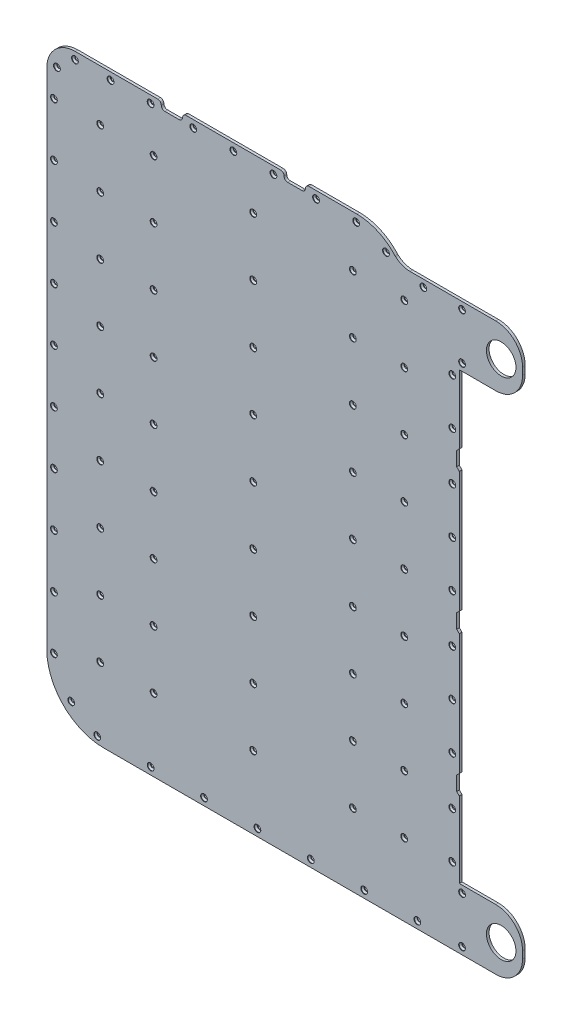
from build123d import *

# Parameters (mm, degrees)
SKETCH1_W                                      = 267.354069382
SKETCH1_H                                      = 331
BOSS_EXTRUDE1_DEPTH                            = 1.5
CUT_EXTRUDE1_DEPTH                             = 426.489657236
CUT_EXTRUDE2_DEPTH                             = 426.489657236
CUT_EXTRUDE3_DEPTH                             = 426.489657236
CUT_EXTRUDE4_DEPTH                             = 426.489657236
M14_CLEARANCE_HOLE1_D                          = 16.15
CSK_FOR_M2_FLAT_HEAD_MACHINE_SCREW1_AT_2_COUNT = 2
CSK_FOR_M2_FLAT_HEAD_MACHINE_SCREW1_AT_2_PITCH = 119.634610245
CSK_FOR_M2_FLAT_HEAD_MACHINE_SCREW1_AT_3_COUNT = 2
CSK_FOR_M2_FLAT_HEAD_MACHINE_SCREW1_AT_3_PITCH = 261.247192787
CSK_FOR_M2_FLAT_HEAD_MACHINE_SCREW1_AT_4_COUNT = 2
CSK_FOR_M2_FLAT_HEAD_MACHINE_SCREW1_AT_4_PITCH = 200.44941981
CSK_FOR_M2_FLAT_HEAD_MACHINE_SCREW1_AT_5_COUNT = 2
CSK_FOR_M2_FLAT_HEAD_MACHINE_SCREW1_AT_5_PITCH = 60
CSK_FOR_M2_FLAT_HEAD_MACHINE_SCREW1_AT_6_COUNT = 2
CSK_FOR_M2_FLAT_HEAD_MACHINE_SCREW1_AT_6_PITCH = 150
CSK_FOR_M2_FLAT_HEAD_MACHINE_SCREW1_AT_7_COUNT = 2
CSK_FOR_M2_FLAT_HEAD_MACHINE_SCREW1_AT_7_PITCH = 104.020522584
CSK_FOR_M2_FLAT_HEAD_MACHINE_SCREW1_AT_8_COUNT = 2
CSK_FOR_M2_FLAT_HEAD_MACHINE_SCREW1_AT_8_PITCH = 304.224078439
CSK_FOR_M2_FLAT_HEAD_MACHINE_SCREW1_AT_9_COUNT = 2
CSK_FOR_M2_FLAT_HEAD_MACHINE_SCREW1_AT_9_PITCH = 241.10255073
CSK_FOR_M2_FLAT_HEAD_MACHINE_SCREW1_AT_1_COUNT = 2
CSK_FOR_M2_FLAT_HEAD_MACHINE_SCREW1_AT_1_PITCH = 151.792937809
CSK_FOR_M2_FLAT_HEAD_MACHINE_SCREW1_2_COUNT    = 2
CSK_FOR_M2_FLAT_HEAD_MACHINE_SCREW1_2_PITCH    = 167.620476666
CSK_FOR_M2_FLAT_HEAD_MACHINE_SCREW1_3_COUNT    = 2
CSK_FOR_M2_FLAT_HEAD_MACHINE_SCREW1_3_PITCH    = 120
CSK_FOR_M2_FLAT_HEAD_MACHINE_SCREW1_4_COUNT    = 2
CSK_FOR_M2_FLAT_HEAD_MACHINE_SCREW1_4_PITCH    = 223.752496974
CSK_FOR_M2_FLAT_HEAD_MACHINE_SCREW1_5_COUNT    = 2
CSK_FOR_M2_FLAT_HEAD_MACHINE_SCREW1_5_PITCH    = 72.949696793
CSK_FOR_M2_FLAT_HEAD_MACHINE_SCREW1_6_COUNT    = 2
CSK_FOR_M2_FLAT_HEAD_MACHINE_SCREW1_6_PITCH    = 295.031085667
CSK_FOR_M2_FLAT_HEAD_MACHINE_SCREW1_7_COUNT    = 2
CSK_FOR_M2_FLAT_HEAD_MACHINE_SCREW1_7_PITCH    = 123.913581739
CSK_FOR_M2_FLAT_HEAD_MACHINE_SCREW1_8_COUNT    = 2
CSK_FOR_M2_FLAT_HEAD_MACHINE_SCREW1_8_PITCH    = 228.699238106
CSK_FOR_M2_FLAT_HEAD_MACHINE_SCREW1_9_COUNT    = 2
CSK_FOR_M2_FLAT_HEAD_MACHINE_SCREW1_9_PITCH    = 164.927901109
CSK_FOR_M2_FLAT_HEAD_MACHINE_SCREW1_10_COUNT   = 2
CSK_FOR_M2_FLAT_HEAD_MACHINE_SCREW1_10_PITCH   = 361.458404112
CSK_FOR_M2_FLAT_HEAD_MACHINE_SCREW1_11_COUNT   = 2
CSK_FOR_M2_FLAT_HEAD_MACHINE_SCREW1_11_PITCH   = 177.537391413
CSK_FOR_M2_FLAT_HEAD_MACHINE_SCREW1_12_COUNT   = 2
CSK_FOR_M2_FLAT_HEAD_MACHINE_SCREW1_12_PITCH   = 233.98480722
CSK_FOR_M2_FLAT_HEAD_MACHINE_SCREW1_13_COUNT   = 2
CSK_FOR_M2_FLAT_HEAD_MACHINE_SCREW1_13_PITCH   = 345.258369211
CSK_FOR_M2_FLAT_HEAD_MACHINE_SCREW1_14_COUNT   = 2
CSK_FOR_M2_FLAT_HEAD_MACHINE_SCREW1_14_PITCH   = 323.987285133
CSK_FOR_M2_FLAT_HEAD_MACHINE_SCREW1_15_COUNT   = 2
CSK_FOR_M2_FLAT_HEAD_MACHINE_SCREW1_15_PITCH   = 322.888559698
CSK_FOR_M2_FLAT_HEAD_MACHINE_SCREW1_16_COUNT   = 2
CSK_FOR_M2_FLAT_HEAD_MACHINE_SCREW1_16_PITCH   = 266.552202251
CSK_FOR_M2_FLAT_HEAD_MACHINE_SCREW1_17_COUNT   = 2
CSK_FOR_M2_FLAT_HEAD_MACHINE_SCREW1_17_PITCH   = 314.841229829
CSK_FOR_M2_FLAT_HEAD_MACHINE_SCREW1_18_COUNT   = 2
CSK_FOR_M2_FLAT_HEAD_MACHINE_SCREW1_18_PITCH   = 316.809987117
CSK_FOR_M2_FLAT_HEAD_MACHINE_SCREW1_19_COUNT   = 2
CSK_FOR_M2_FLAT_HEAD_MACHINE_SCREW1_19_PITCH   = 227.93936126
CSK_FOR_M2_FLAT_HEAD_MACHINE_SCREW1_20_COUNT   = 2
CSK_FOR_M2_FLAT_HEAD_MACHINE_SCREW1_20_PITCH   = 180.092587027
CSK_FOR_M2_FLAT_HEAD_MACHINE_SCREW1_21_COUNT   = 2
CSK_FOR_M2_FLAT_HEAD_MACHINE_SCREW1_21_PITCH   = 279.91283558
CSK_FOR_M2_FLAT_HEAD_MACHINE_SCREW1_22_COUNT   = 2
CSK_FOR_M2_FLAT_HEAD_MACHINE_SCREW1_22_PITCH   = 232.986660987
CSK_FOR_M2_FLAT_HEAD_MACHINE_SCREW1_23_COUNT   = 2
CSK_FOR_M2_FLAT_HEAD_MACHINE_SCREW1_23_PITCH   = 62.685137884
CSK_FOR_M2_FLAT_HEAD_MACHINE_SCREW1_24_COUNT   = 2
CSK_FOR_M2_FLAT_HEAD_MACHINE_SCREW1_24_PITCH   = 272.821168476
CSK_FOR_M2_FLAT_HEAD_MACHINE_SCREW1_25_COUNT   = 2
CSK_FOR_M2_FLAT_HEAD_MACHINE_SCREW1_25_PITCH   = 352.917909887
CSK_FOR_M2_FLAT_HEAD_MACHINE_SCREW1_26_COUNT   = 2
CSK_FOR_M2_FLAT_HEAD_MACHINE_SCREW1_26_PITCH   = 298.36766614
CSK_FOR_M2_FLAT_HEAD_MACHINE_SCREW1_27_COUNT   = 2
CSK_FOR_M2_FLAT_HEAD_MACHINE_SCREW1_27_PITCH   = 304.747305105
CSK_FOR_M2_FLAT_HEAD_MACHINE_SCREW1_28_COUNT   = 2
CSK_FOR_M2_FLAT_HEAD_MACHINE_SCREW1_28_PITCH   = 178.729628122
CSK_FOR_M2_FLAT_HEAD_MACHINE_SCREW1_29_COUNT   = 2
CSK_FOR_M2_FLAT_HEAD_MACHINE_SCREW1_29_PITCH   = 148.522961082
CSK_FOR_M2_FLAT_HEAD_MACHINE_SCREW1_30_COUNT   = 2
CSK_FOR_M2_FLAT_HEAD_MACHINE_SCREW1_30_PITCH   = 176.588055967
CSK_FOR_M2_FLAT_HEAD_MACHINE_SCREW1_31_COUNT   = 2
CSK_FOR_M2_FLAT_HEAD_MACHINE_SCREW1_31_PITCH   = 358.429099418
CSK_FOR_M2_FLAT_HEAD_MACHINE_SCREW1_32_COUNT   = 2
CSK_FOR_M2_FLAT_HEAD_MACHINE_SCREW1_32_PITCH   = 200.300809279
CSK_FOR_M2_FLAT_HEAD_MACHINE_SCREW1_33_COUNT   = 2
CSK_FOR_M2_FLAT_HEAD_MACHINE_SCREW1_33_PITCH   = 43.034312803
CSK_FOR_M2_FLAT_HEAD_MACHINE_SCREW1_34_COUNT   = 2
CSK_FOR_M2_FLAT_HEAD_MACHINE_SCREW1_34_PITCH   = 69.690273336
CSK_FOR_M2_FLAT_HEAD_MACHINE_SCREW1_35_COUNT   = 2
CSK_FOR_M2_FLAT_HEAD_MACHINE_SCREW1_35_PITCH   = 156.307695714
CSK_FOR_M2_FLAT_HEAD_MACHINE_SCREW1_36_COUNT   = 2
CSK_FOR_M2_FLAT_HEAD_MACHINE_SCREW1_36_PITCH   = 319.723851957
CSK_FOR_M2_FLAT_HEAD_MACHINE_SCREW1_37_COUNT   = 2
CSK_FOR_M2_FLAT_HEAD_MACHINE_SCREW1_37_PITCH   = 326.860477855
CSK_FOR_M2_FLAT_HEAD_MACHINE_SCREW1_38_COUNT   = 2
CSK_FOR_M2_FLAT_HEAD_MACHINE_SCREW1_38_PITCH   = 179.384296245
CSK_FOR_M2_FLAT_HEAD_MACHINE_SCREW1_39_COUNT   = 2
CSK_FOR_M2_FLAT_HEAD_MACHINE_SCREW1_39_PITCH   = 271.409914171
CSK_FOR_M2_FLAT_HEAD_MACHINE_SCREW1_40_COUNT   = 2
CSK_FOR_M2_FLAT_HEAD_MACHINE_SCREW1_40_PITCH   = 60.829191626
CSK_FOR_M2_FLAT_HEAD_MACHINE_SCREW1_41_COUNT   = 2
CSK_FOR_M2_FLAT_HEAD_MACHINE_SCREW1_41_PITCH   = 81.288620654
CSK_FOR_M2_FLAT_HEAD_MACHINE_SCREW1_42_COUNT   = 2
CSK_FOR_M2_FLAT_HEAD_MACHINE_SCREW1_42_PITCH   = 137.200749777
CSK_FOR_M2_FLAT_HEAD_MACHINE_SCREW1_43_COUNT   = 2
CSK_FOR_M2_FLAT_HEAD_MACHINE_SCREW1_43_PITCH   = 299.148530157
CSK_FOR_M2_FLAT_HEAD_MACHINE_SCREW1_44_COUNT   = 2
CSK_FOR_M2_FLAT_HEAD_MACHINE_SCREW1_44_PITCH   = 136.663128881
CSK_FOR_M2_FLAT_HEAD_MACHINE_SCREW1_45_COUNT   = 2
CSK_FOR_M2_FLAT_HEAD_MACHINE_SCREW1_45_PITCH   = 336.827510729
CSK_FOR_M2_FLAT_HEAD_MACHINE_SCREW1_46_COUNT   = 2
CSK_FOR_M2_FLAT_HEAD_MACHINE_SCREW1_46_PITCH   = 331.117837006
CSK_FOR_M2_FLAT_HEAD_MACHINE_SCREW1_47_COUNT   = 2
CSK_FOR_M2_FLAT_HEAD_MACHINE_SCREW1_47_PITCH   = 320.921447927
CSK_FOR_M2_FLAT_HEAD_MACHINE_SCREW1_48_COUNT   = 2
CSK_FOR_M2_FLAT_HEAD_MACHINE_SCREW1_48_PITCH   = 344.446706307
CSK_FOR_M2_FLAT_HEAD_MACHINE_SCREW1_49_COUNT   = 2
CSK_FOR_M2_FLAT_HEAD_MACHINE_SCREW1_49_PITCH   = 209.685645595
CSK_FOR_M2_FLAT_HEAD_MACHINE_SCREW1_50_COUNT   = 2
CSK_FOR_M2_FLAT_HEAD_MACHINE_SCREW1_50_PITCH   = 90
CSK_FOR_M2_FLAT_HEAD_MACHINE_SCREW1_51_COUNT   = 2
CSK_FOR_M2_FLAT_HEAD_MACHINE_SCREW1_51_PITCH   = 152.826110015
CSK_FOR_M2_FLAT_HEAD_MACHINE_SCREW1_52_COUNT   = 2
CSK_FOR_M2_FLAT_HEAD_MACHINE_SCREW1_52_PITCH   = 93.297320264
CSK_FOR_M2_FLAT_HEAD_MACHINE_SCREW1_53_COUNT   = 2
CSK_FOR_M2_FLAT_HEAD_MACHINE_SCREW1_53_PITCH   = 289.276684162
CSK_FOR_M2_FLAT_HEAD_MACHINE_SCREW1_54_COUNT   = 2
CSK_FOR_M2_FLAT_HEAD_MACHINE_SCREW1_54_PITCH   = 311.778234918
CSK_FOR_M2_FLAT_HEAD_MACHINE_SCREW1_55_COUNT   = 2
CSK_FOR_M2_FLAT_HEAD_MACHINE_SCREW1_55_PITCH   = 254.363483823
CSK_FOR_M2_FLAT_HEAD_MACHINE_SCREW1_56_COUNT   = 2
CSK_FOR_M2_FLAT_HEAD_MACHINE_SCREW1_56_PITCH   = 201.460377121
CSK_FOR_M2_FLAT_HEAD_MACHINE_SCREW1_57_COUNT   = 2
CSK_FOR_M2_FLAT_HEAD_MACHINE_SCREW1_57_PITCH   = 202.637456713
CSK_FOR_M2_FLAT_HEAD_MACHINE_SCREW1_58_COUNT   = 2
CSK_FOR_M2_FLAT_HEAD_MACHINE_SCREW1_58_PITCH   = 169.003719323
CSK_FOR_M2_FLAT_HEAD_MACHINE_SCREW1_59_COUNT   = 2
CSK_FOR_M2_FLAT_HEAD_MACHINE_SCREW1_59_PITCH   = 290.77662516
CSK_FOR_M2_FLAT_HEAD_MACHINE_SCREW1_60_COUNT   = 2
CSK_FOR_M2_FLAT_HEAD_MACHINE_SCREW1_60_PITCH   = 265.675994771
CSK_FOR_M2_FLAT_HEAD_MACHINE_SCREW1_61_COUNT   = 2
CSK_FOR_M2_FLAT_HEAD_MACHINE_SCREW1_61_PITCH   = 205.094943232
CSK_FOR_M2_FLAT_HEAD_MACHINE_SCREW1_62_COUNT   = 2
CSK_FOR_M2_FLAT_HEAD_MACHINE_SCREW1_62_PITCH   = 210.531093927
CSK_FOR_M2_FLAT_HEAD_MACHINE_SCREW1_63_COUNT   = 2
CSK_FOR_M2_FLAT_HEAD_MACHINE_SCREW1_63_PITCH   = 30
CSK_FOR_M2_FLAT_HEAD_MACHINE_SCREW1_64_COUNT   = 2
CSK_FOR_M2_FLAT_HEAD_MACHINE_SCREW1_64_PITCH   = 183.748038112
CSK_FOR_M2_FLAT_HEAD_MACHINE_SCREW1_65_COUNT   = 2
CSK_FOR_M2_FLAT_HEAD_MACHINE_SCREW1_65_PITCH   = 72.352746793
CSK_FOR_M2_FLAT_HEAD_MACHINE_SCREW1_66_COUNT   = 2
CSK_FOR_M2_FLAT_HEAD_MACHINE_SCREW1_66_PITCH   = 195.303204045
CSK_FOR_M2_FLAT_HEAD_MACHINE_SCREW1_67_COUNT   = 2
CSK_FOR_M2_FLAT_HEAD_MACHINE_SCREW1_67_PITCH   = 249.176583776
CSK_FOR_M2_FLAT_HEAD_MACHINE_SCREW1_68_COUNT   = 2
CSK_FOR_M2_FLAT_HEAD_MACHINE_SCREW1_68_PITCH   = 276.1364516
CSK_FOR_M2_FLAT_HEAD_MACHINE_SCREW1_69_COUNT   = 2
CSK_FOR_M2_FLAT_HEAD_MACHINE_SCREW1_69_PITCH   = 102.297527818
CSK_FOR_M2_FLAT_HEAD_MACHINE_SCREW1_70_COUNT   = 2
CSK_FOR_M2_FLAT_HEAD_MACHINE_SCREW1_70_PITCH   = 127.493852896
CSK_FOR_M2_FLAT_HEAD_MACHINE_SCREW1_71_COUNT   = 2
CSK_FOR_M2_FLAT_HEAD_MACHINE_SCREW1_71_PITCH   = 104.546374884
CSK_FOR_M2_FLAT_HEAD_MACHINE_SCREW1_72_COUNT   = 2
CSK_FOR_M2_FLAT_HEAD_MACHINE_SCREW1_72_PITCH   = 249.165289537
CSK_FOR_M2_FLAT_HEAD_MACHINE_SCREW1_73_COUNT   = 2
CSK_FOR_M2_FLAT_HEAD_MACHINE_SCREW1_73_PITCH   = 232.567679911
CSK_FOR_M2_FLAT_HEAD_MACHINE_SCREW1_74_COUNT   = 2
CSK_FOR_M2_FLAT_HEAD_MACHINE_SCREW1_74_PITCH   = 37.245995727
CSK_FOR_M2_FLAT_HEAD_MACHINE_SCREW1_75_COUNT   = 2
CSK_FOR_M2_FLAT_HEAD_MACHINE_SCREW1_75_PITCH   = 29.875
CSK_FOR_M2_FLAT_HEAD_MACHINE_SCREW1_76_COUNT   = 2
CSK_FOR_M2_FLAT_HEAD_MACHINE_SCREW1_76_PITCH   = 134.949672833
CSK_FOR_M2_FLAT_HEAD_MACHINE_SCREW1_77_COUNT   = 2
CSK_FOR_M2_FLAT_HEAD_MACHINE_SCREW1_77_PITCH   = 163.784278556
CSK_FOR_M2_FLAT_HEAD_MACHINE_SCREW1_78_COUNT   = 2
CSK_FOR_M2_FLAT_HEAD_MACHINE_SCREW1_78_PITCH   = 55
CSK_FOR_M2_FLAT_HEAD_MACHINE_SCREW1_79_COUNT   = 2
CSK_FOR_M2_FLAT_HEAD_MACHINE_SCREW1_79_PITCH   = 333.154348467
FILLET1_R                                      = 12
FILLET2_R                                      = 16
FILLET3_R                                      = 32
FILLET4_R                                      = 15
SKETCH10_R                                     = 8.3
CUT_EXTRUDE5_DEPTH                             = 10


with BuildPart() as part:
    # Sketch1 → Boss-Extrude1 (new body)
    with BuildSketch(Plane.XY.offset(1.5)):
        with Locations((133.677034691, 165.5)):
            Rectangle(SKETCH1_W, SKETCH1_H)
    extrude(amount=-BOSS_EXTRUDE1_DEPTH)

    # Sketch2 → Cut-Extrude1 (cut, through all)
    with BuildSketch(Plane(origin=(0, 0, 0), x_dir=(-1, 0, 0), z_dir=(0, 0, -1))):
        Polygon((-267.354069382, 284), (-267.354069382, 33.984429066), (-231.807915836, 33.984429066), (-231.814759233, 76.575880869), (-230.354069382, 78), (-230.354069382, 86), (-231.816514469, 87.5), (-231.827440394, 155.5), (-230.354069382, 157), (-230.354069382, 165), (-231.829207823, 166.5), (-231.840133747, 234.5), (-230.354069382, 236), (-230.354069382, 244), (-231.841901176, 245.5), (-231.848087178, 284), align=None)
    extrude(amount=-CUT_EXTRUDE1_DEPTH, mode=Mode.SUBTRACT)

    # Sketch3 → Cut-Extrude2 (cut, through all)
    with BuildSketch(Plane(origin=(0, 0, 0), x_dir=(-1, 0, 0), z_dir=(0, 0, -1))):
        with BuildLine():
            Line((-174.225389185, 331), (-267.354069382, 331))
            Line((-267.354069382, 331), (-267.354069382, 318))
            Line((-267.354069382, 318), (-199.499948995, 318))
            Line((-199.499948995, 318), (-195.692740955, 321.412638885))
            ThreePointArc((-195.692740955, 321.412638885), (-185.974632113, 328.480306486), (-174.225389185, 331))
        make_face()
    extrude(amount=-CUT_EXTRUDE2_DEPTH, mode=Mode.SUBTRACT)

    # Sketch4 → Cut-Extrude3 (cut, through all)
    with BuildSketch(Plane(origin=(0, 0, 0), x_dir=(-1, 0, 0), z_dir=(0, 0, -1))):
        with BuildLine():
            Line((-131.354069382, 331), (-147.354069382, 331))
            ThreePointArc((-147.354069382, 331), (-145.93985582, 330.414213562), (-145.354069382, 329))
            ThreePointArc((-145.354069382, 329), (-144.768282945, 327.585786438), (-143.354069382, 327))
            Line((-143.354069382, 327), (-135.354069382, 327))
            ThreePointArc((-135.354069382, 327), (-133.93985582, 327.585786438), (-133.354069382, 329))
            ThreePointArc((-133.354069382, 329), (-132.768282945, 330.414213562), (-131.354069382, 331))
        make_face()
    extrude(amount=-CUT_EXTRUDE3_DEPTH, mode=Mode.SUBTRACT)

    # Sketch5 → Cut-Extrude4 (cut, through all)
    with BuildSketch(Plane(origin=(0, 0, 0), x_dir=(-1, 0, 0), z_dir=(0, 0, -1))):
        with BuildLine():
            Line((-62.325899763, 331), (-78.325899763, 331))
            ThreePointArc((-78.325899763, 331), (-76.911686201, 330.414213562), (-76.325899763, 329))
            ThreePointArc((-76.325899763, 329), (-75.740113325, 327.585786438), (-74.325899763, 327))
            Line((-74.325899763, 327), (-66.325899763, 327))
            ThreePointArc((-66.325899763, 327), (-64.911686201, 327.585786438), (-64.325899763, 329))
            ThreePointArc((-64.325899763, 329), (-63.740113325, 330.414213562), (-62.325899763, 331))
        make_face()
    extrude(amount=-CUT_EXTRUDE4_DEPTH, mode=Mode.SUBTRACT)

    # M14 Clearance Hole1 (through all)
    with Locations(Plane.XY.offset(1.5)):
        with Locations((255.354069382, 16.992214533), (255.354069382, 301.007785467)):
            Hole(M14_CLEARANCE_HOLE1_D / 2)

    # Sketch8 → CSK for M2 Flat Head Machine Screw1 (revolve, cut)
    with BuildSketch(Plane(origin=(178.354069382, 4, 1.5), x_dir=(0, -1, 0), z_dir=(1, 0, 0))):
        Polygon((0, 0), (0, 1.5), (1.1, 1.5), (1.1, 1.1), (1.9, 0.3), (1.9, 0), align=None)
    csk_for_m2_flat_head_machine_screw1 = revolve(axis=Axis((178.354069382, 4, 7.85), (0, 0, -1)), mode=Mode.SUBTRACT)

    # CSK for M2 Flat Head Machine Screw1 at 2: CSK for M2 Flat Head Machine Screw1 ×2
    with Locations(*[Vector(-0.5212042673470071, 0.8534319607908234, 0) * (i * CSK_FOR_M2_FLAT_HEAD_MACHINE_SCREW1_AT_2_PITCH) for i in range(1, CSK_FOR_M2_FLAT_HEAD_MACHINE_SCREW1_AT_2_COUNT)]):
        add(csk_for_m2_flat_head_machine_screw1, mode=Mode.SUBTRACT)

    # CSK for M2 Flat Head Machine Screw1 at 3: CSK for M2 Flat Head Machine Screw1 ×2
    with Locations(*[Vector(-0.45303479864942126, 0.8914928329564284, 0) * (i * CSK_FOR_M2_FLAT_HEAD_MACHINE_SCREW1_AT_3_PITCH) for i in range(1, CSK_FOR_M2_FLAT_HEAD_MACHINE_SCREW1_AT_3_COUNT)]):
        add(csk_for_m2_flat_head_machine_screw1, mode=Mode.SUBTRACT)

    # CSK for M2 Flat Head Machine Screw1 at 4: CSK for M2 Flat Head Machine Screw1 ×2
    with Locations(*[Vector(-0.7401072526058902, 0.6724888509411597, 0) * (i * CSK_FOR_M2_FLAT_HEAD_MACHINE_SCREW1_AT_4_PITCH) for i in range(1, CSK_FOR_M2_FLAT_HEAD_MACHINE_SCREW1_AT_4_COUNT)]):
        add(csk_for_m2_flat_head_machine_screw1, mode=Mode.SUBTRACT)

    # CSK for M2 Flat Head Machine Screw1 at 5: CSK for M2 Flat Head Machine Screw1 ×2
    with Locations(*[(-i * CSK_FOR_M2_FLAT_HEAD_MACHINE_SCREW1_AT_5_PITCH, 0, 0) for i in range(1, CSK_FOR_M2_FLAT_HEAD_MACHINE_SCREW1_AT_5_COUNT)]):
        add(csk_for_m2_flat_head_machine_screw1, mode=Mode.SUBTRACT)

    # CSK for M2 Flat Head Machine Screw1 at 6: CSK for M2 Flat Head Machine Screw1 ×2
    with Locations(*[(-i * CSK_FOR_M2_FLAT_HEAD_MACHINE_SCREW1_AT_6_PITCH, 0, 0) for i in range(1, CSK_FOR_M2_FLAT_HEAD_MACHINE_SCREW1_AT_6_COUNT)]):
        add(csk_for_m2_flat_head_machine_screw1, mode=Mode.SUBTRACT)

    # CSK for M2 Flat Head Machine Screw1 at 7: CSK for M2 Flat Head Machine Screw1 ×2
    with Locations(*[Vector(0.47565095314554157, 0.8796341118736459, 0) * (i * CSK_FOR_M2_FLAT_HEAD_MACHINE_SCREW1_AT_7_PITCH) for i in range(1, CSK_FOR_M2_FLAT_HEAD_MACHINE_SCREW1_AT_7_COUNT)]):
        add(csk_for_m2_flat_head_machine_screw1, mode=Mode.SUBTRACT)

    # CSK for M2 Flat Head Machine Screw1 at 8: CSK for M2 Flat Head Machine Screw1 ×2
    with Locations(*[Vector(-0.4876473622444672, 0.8730406921192239, 0) * (i * CSK_FOR_M2_FLAT_HEAD_MACHINE_SCREW1_AT_8_PITCH) for i in range(1, CSK_FOR_M2_FLAT_HEAD_MACHINE_SCREW1_AT_8_COUNT)]):
        add(csk_for_m2_flat_head_machine_screw1, mode=Mode.SUBTRACT)

    # CSK for M2 Flat Head Machine Screw1 at 9: CSK for M2 Flat Head Machine Screw1 ×2
    with Locations(*[Vector(-0.2586205297015454, 0.9659789964677763, 0) * (i * CSK_FOR_M2_FLAT_HEAD_MACHINE_SCREW1_AT_9_PITCH) for i in range(1, CSK_FOR_M2_FLAT_HEAD_MACHINE_SCREW1_AT_9_COUNT)]):
        add(csk_for_m2_flat_head_machine_screw1, mode=Mode.SUBTRACT)

    # CSK for M2 Flat Head Machine Screw1 at 1: CSK for M2 Flat Head Machine Screw1 ×2
    with Locations(*[Vector(0.32600868358523344, 0.9453667744463116, 0) * (i * CSK_FOR_M2_FLAT_HEAD_MACHINE_SCREW1_AT_1_PITCH) for i in range(1, CSK_FOR_M2_FLAT_HEAD_MACHINE_SCREW1_AT_1_COUNT)]):
        add(csk_for_m2_flat_head_machine_screw1, mode=Mode.SUBTRACT)

    # CSK for M2 Flat Head Machine Screw1  2: CSK for M2 Flat Head Machine Screw1 ×2
    with Locations(*[Vector(-0.0379074771088598, 0.999281253291205, 0) * (i * CSK_FOR_M2_FLAT_HEAD_MACHINE_SCREW1_2_PITCH) for i in range(1, CSK_FOR_M2_FLAT_HEAD_MACHINE_SCREW1_2_COUNT)]):
        add(csk_for_m2_flat_head_machine_screw1, mode=Mode.SUBTRACT)

    # CSK for M2 Flat Head Machine Screw1  3: CSK for M2 Flat Head Machine Screw1 ×2
    with Locations(*[(-i * CSK_FOR_M2_FLAT_HEAD_MACHINE_SCREW1_3_PITCH, 0, 0) for i in range(1, CSK_FOR_M2_FLAT_HEAD_MACHINE_SCREW1_3_COUNT)]):
        add(csk_for_m2_flat_head_machine_screw1, mode=Mode.SUBTRACT)

    # CSK for M2 Flat Head Machine Screw1  4: CSK for M2 Flat Head Machine Screw1 ×2
    with Locations(*[Vector(-0.6630275477962505, 0.7485949978882379, 0) * (i * CSK_FOR_M2_FLAT_HEAD_MACHINE_SCREW1_4_PITCH) for i in range(1, CSK_FOR_M2_FLAT_HEAD_MACHINE_SCREW1_4_COUNT)]):
        add(csk_for_m2_flat_head_machine_screw1, mode=Mode.SUBTRACT)

    # CSK for M2 Flat Head Machine Screw1  5: CSK for M2 Flat Head Machine Screw1 ×2
    with Locations(*[Vector(0.3081416552854714, 0.9513404859869729, 0) * (i * CSK_FOR_M2_FLAT_HEAD_MACHINE_SCREW1_5_PITCH) for i in range(1, CSK_FOR_M2_FLAT_HEAD_MACHINE_SCREW1_5_COUNT)]):
        add(csk_for_m2_flat_head_machine_screw1, mode=Mode.SUBTRACT)

    # CSK for M2 Flat Head Machine Screw1  6: CSK for M2 Flat Head Machine Screw1 ×2
    with Locations(*[Vector(-0.5909684702807935, 0.8066946554514782, 0) * (i * CSK_FOR_M2_FLAT_HEAD_MACHINE_SCREW1_6_PITCH) for i in range(1, CSK_FOR_M2_FLAT_HEAD_MACHINE_SCREW1_6_COUNT)]):
        add(csk_for_m2_flat_head_machine_screw1, mode=Mode.SUBTRACT)

    # CSK for M2 Flat Head Machine Screw1  7: CSK for M2 Flat Head Machine Screw1 ×2
    with Locations(*[Vector(-0.9551339548212321, 0.2961741520584681, 0) * (i * CSK_FOR_M2_FLAT_HEAD_MACHINE_SCREW1_7_PITCH) for i in range(1, CSK_FOR_M2_FLAT_HEAD_MACHINE_SCREW1_7_COUNT)]):
        add(csk_for_m2_flat_head_machine_screw1, mode=Mode.SUBTRACT)

    # CSK for M2 Flat Head Machine Screw1  8: CSK for M2 Flat Head Machine Screw1 ×2
    with Locations(*[Vector(-0.7623727600771633, 0.6471381418926937, 0) * (i * CSK_FOR_M2_FLAT_HEAD_MACHINE_SCREW1_8_PITCH) for i in range(1, CSK_FOR_M2_FLAT_HEAD_MACHINE_SCREW1_8_COUNT)]):
        add(csk_for_m2_flat_head_machine_screw1, mode=Mode.SUBTRACT)

    # CSK for M2 Flat Head Machine Screw1  9: CSK for M2 Flat Head Machine Screw1 ×2
    with Locations(*[Vector(-0.9983396882840878, 0.05760092704835812, 0) * (i * CSK_FOR_M2_FLAT_HEAD_MACHINE_SCREW1_9_PITCH) for i in range(1, CSK_FOR_M2_FLAT_HEAD_MACHINE_SCREW1_9_COUNT)]):
        add(csk_for_m2_flat_head_machine_screw1, mode=Mode.SUBTRACT)

    # CSK for M2 Flat Head Machine Screw1  10: CSK for M2 Flat Head Machine Screw1 ×2
    with Locations(*[Vector(-0.4496455685361018, 0.8932070659683822, 0) * (i * CSK_FOR_M2_FLAT_HEAD_MACHINE_SCREW1_10_PITCH) for i in range(1, CSK_FOR_M2_FLAT_HEAD_MACHINE_SCREW1_10_COUNT)]):
        add(csk_for_m2_flat_head_machine_screw1, mode=Mode.SUBTRACT)

    # CSK for M2 Flat Head Machine Screw1  11: CSK for M2 Flat Head Machine Screw1 ×2
    with Locations(*[Vector(0.27875904717026245, 0.9603610746072164, 0) * (i * CSK_FOR_M2_FLAT_HEAD_MACHINE_SCREW1_11_PITCH) for i in range(1, CSK_FOR_M2_FLAT_HEAD_MACHINE_SCREW1_11_COUNT)]):
        add(csk_for_m2_flat_head_machine_screw1, mode=Mode.SUBTRACT)

    # CSK for M2 Flat Head Machine Screw1  12: CSK for M2 Flat Head Machine Screw1 ×2
    with Locations(*[Vector(0.0961819316869119, 0.995363770697414, 0) * (i * CSK_FOR_M2_FLAT_HEAD_MACHINE_SCREW1_12_PITCH) for i in range(1, CSK_FOR_M2_FLAT_HEAD_MACHINE_SCREW1_12_COUNT)]):
        add(csk_for_m2_flat_head_machine_screw1, mode=Mode.SUBTRACT)

    # CSK for M2 Flat Head Machine Screw1  13: CSK for M2 Flat Head Machine Screw1 ×2
    with Locations(*[Vector(-0.5049959245903639, 0.8631217273056702, 0) * (i * CSK_FOR_M2_FLAT_HEAD_MACHINE_SCREW1_13_PITCH) for i in range(1, CSK_FOR_M2_FLAT_HEAD_MACHINE_SCREW1_13_COUNT)]):
        add(csk_for_m2_flat_head_machine_screw1, mode=Mode.SUBTRACT)

    # CSK for M2 Flat Head Machine Screw1  14: CSK for M2 Flat Head Machine Screw1 ×2
    with Locations(*[Vector(-0.08345021070280355, 0.9965119479131486, 0) * (i * CSK_FOR_M2_FLAT_HEAD_MACHINE_SCREW1_14_PITCH) for i in range(1, CSK_FOR_M2_FLAT_HEAD_MACHINE_SCREW1_14_COUNT)]):
        add(csk_for_m2_flat_head_machine_screw1, mode=Mode.SUBTRACT)

    # CSK for M2 Flat Head Machine Screw1  15: CSK for M2 Flat Head Machine Screw1 ×2
    with Locations(*[Vector(-0.01393669693411205, 0.9999028795230899, 0) * (i * CSK_FOR_M2_FLAT_HEAD_MACHINE_SCREW1_15_PITCH) for i in range(1, CSK_FOR_M2_FLAT_HEAD_MACHINE_SCREW1_15_COUNT)]):
        add(csk_for_m2_flat_head_machine_screw1, mode=Mode.SUBTRACT)

    # CSK for M2 Flat Head Machine Screw1  16: CSK for M2 Flat Head Machine Screw1 ×2
    with Locations(*[Vector(0.08445011760532944, 0.9964277081838131, 0) * (i * CSK_FOR_M2_FLAT_HEAD_MACHINE_SCREW1_16_PITCH) for i in range(1, CSK_FOR_M2_FLAT_HEAD_MACHINE_SCREW1_16_COUNT)]):
        add(csk_for_m2_flat_head_machine_screw1, mode=Mode.SUBTRACT)

    # CSK for M2 Flat Head Machine Screw1  17: CSK for M2 Flat Head Machine Screw1 ×2
    with Locations(*[Vector(0.1746912246211783, 0.9846232660466404, 0) * (i * CSK_FOR_M2_FLAT_HEAD_MACHINE_SCREW1_17_PITCH) for i in range(1, CSK_FOR_M2_FLAT_HEAD_MACHINE_SCREW1_17_COUNT)]):
        add(csk_for_m2_flat_head_machine_screw1, mode=Mode.SUBTRACT)

    # CSK for M2 Flat Head Machine Screw1  18: CSK for M2 Flat Head Machine Screw1 ×2
    with Locations(*[Vector(0.03866858121133907, 0.9992520907294126, 0) * (i * CSK_FOR_M2_FLAT_HEAD_MACHINE_SCREW1_18_PITCH) for i in range(1, CSK_FOR_M2_FLAT_HEAD_MACHINE_SCREW1_18_COUNT)]):
        add(csk_for_m2_flat_head_machine_screw1, mode=Mode.SUBTRACT)

    # CSK for M2 Flat Head Machine Screw1  19: CSK for M2 Flat Head Machine Screw1 ×2
    with Locations(*[Vector(0.21715647930376925, 0.9761368057277585, 0) * (i * CSK_FOR_M2_FLAT_HEAD_MACHINE_SCREW1_19_PITCH) for i in range(1, CSK_FOR_M2_FLAT_HEAD_MACHINE_SCREW1_19_COUNT)]):
        add(csk_for_m2_flat_head_machine_screw1, mode=Mode.SUBTRACT)

    # CSK for M2 Flat Head Machine Screw1  20: CSK for M2 Flat Head Machine Screw1 ×2
    with Locations(*[Vector(-0.8237655521020476, 0.5669306087785425, 0) * (i * CSK_FOR_M2_FLAT_HEAD_MACHINE_SCREW1_20_PITCH) for i in range(1, CSK_FOR_M2_FLAT_HEAD_MACHINE_SCREW1_20_COUNT)]):
        add(csk_for_m2_flat_head_machine_screw1, mode=Mode.SUBTRACT)

    # CSK for M2 Flat Head Machine Screw1  21: CSK for M2 Flat Head Machine Screw1 ×2
    with Locations(*[Vector(0.17686586210838603, 0.9842349652499943, 0) * (i * CSK_FOR_M2_FLAT_HEAD_MACHINE_SCREW1_21_PITCH) for i in range(1, CSK_FOR_M2_FLAT_HEAD_MACHINE_SCREW1_21_COUNT)]):
        add(csk_for_m2_flat_head_machine_screw1, mode=Mode.SUBTRACT)

    # CSK for M2 Flat Head Machine Screw1  22: CSK for M2 Flat Head Machine Screw1 ×2
    with Locations(*[Vector(-0.027272245352079116, 0.9996280431407755, 0) * (i * CSK_FOR_M2_FLAT_HEAD_MACHINE_SCREW1_22_PITCH) for i in range(1, CSK_FOR_M2_FLAT_HEAD_MACHINE_SCREW1_22_COUNT)]):
        add(csk_for_m2_flat_head_machine_screw1, mode=Mode.SUBTRACT)

    # CSK for M2 Flat Head Machine Screw1  23: CSK for M2 Flat Head Machine Screw1 ×2
    with Locations(*[Vector(0.7891654479841002, 0.6141806702494427, 0) * (i * CSK_FOR_M2_FLAT_HEAD_MACHINE_SCREW1_23_PITCH) for i in range(1, CSK_FOR_M2_FLAT_HEAD_MACHINE_SCREW1_23_COUNT)]):
        add(csk_for_m2_flat_head_machine_screw1, mode=Mode.SUBTRACT)

    # CSK for M2 Flat Head Machine Screw1  24: CSK for M2 Flat Head Machine Screw1 ×2
    with Locations(*[Vector(-0.22855290053386507, 0.9735314949489602, 0) * (i * CSK_FOR_M2_FLAT_HEAD_MACHINE_SCREW1_24_PITCH) for i in range(1, CSK_FOR_M2_FLAT_HEAD_MACHINE_SCREW1_24_COUNT)]):
        add(csk_for_m2_flat_head_machine_screw1, mode=Mode.SUBTRACT)

    # CSK for M2 Flat Head Machine Screw1  25: CSK for M2 Flat Head Machine Screw1 ×2
    with Locations(*[Vector(-0.40385643694047463, 0.9148223752957426, 0) * (i * CSK_FOR_M2_FLAT_HEAD_MACHINE_SCREW1_25_PITCH) for i in range(1, CSK_FOR_M2_FLAT_HEAD_MACHINE_SCREW1_25_COUNT)]):
        add(csk_for_m2_flat_head_machine_screw1, mode=Mode.SUBTRACT)

    # CSK for M2 Flat Head Machine Screw1  26: CSK for M2 Flat Head Machine Screw1 ×2
    with Locations(*[Vector(-0.021296105789199906, 0.9997732122227597, 0) * (i * CSK_FOR_M2_FLAT_HEAD_MACHINE_SCREW1_26_PITCH) for i in range(1, CSK_FOR_M2_FLAT_HEAD_MACHINE_SCREW1_26_COUNT)]):
        add(csk_for_m2_flat_head_machine_screw1, mode=Mode.SUBTRACT)

    # CSK for M2 Flat Head Machine Screw1  27: CSK for M2 Flat Head Machine Screw1 ×2
    with Locations(*[Vector(-0.20460909198454397, 0.9788437666335014, 0) * (i * CSK_FOR_M2_FLAT_HEAD_MACHINE_SCREW1_27_PITCH) for i in range(1, CSK_FOR_M2_FLAT_HEAD_MACHINE_SCREW1_27_COUNT)]):
        add(csk_for_m2_flat_head_machine_screw1, mode=Mode.SUBTRACT)

    # CSK for M2 Flat Head Machine Screw1  28: CSK for M2 Flat Head Machine Screw1 ×2
    with Locations(*[Vector(-0.348873715217122, 0.9371697449398388, 0) * (i * CSK_FOR_M2_FLAT_HEAD_MACHINE_SCREW1_28_PITCH) for i in range(1, CSK_FOR_M2_FLAT_HEAD_MACHINE_SCREW1_28_COUNT)]):
        add(csk_for_m2_flat_head_machine_screw1, mode=Mode.SUBTRACT)

    # CSK for M2 Flat Head Machine Screw1  29: CSK for M2 Flat Head Machine Screw1 ×2
    with Locations(*[Vector(-0.4198278093030311, 0.9076037739761872, 0) * (i * CSK_FOR_M2_FLAT_HEAD_MACHINE_SCREW1_29_PITCH) for i in range(1, CSK_FOR_M2_FLAT_HEAD_MACHINE_SCREW1_29_COUNT)]):
        add(csk_for_m2_flat_head_machine_screw1, mode=Mode.SUBTRACT)

    # CSK for M2 Flat Head Machine Screw1  30: CSK for M2 Flat Head Machine Screw1 ×2
    with Locations(*[Vector(-0.987349163722498, 0.15856112038101908, 0) * (i * CSK_FOR_M2_FLAT_HEAD_MACHINE_SCREW1_30_PITCH) for i in range(1, CSK_FOR_M2_FLAT_HEAD_MACHINE_SCREW1_30_COUNT)]):
        add(csk_for_m2_flat_head_machine_screw1, mode=Mode.SUBTRACT)

    # CSK for M2 Flat Head Machine Screw1  31: CSK for M2 Flat Head Machine Screw1 ×2
    with Locations(*[Vector(-0.48168167402311796, 0.8763462585703705, 0) * (i * CSK_FOR_M2_FLAT_HEAD_MACHINE_SCREW1_31_PITCH) for i in range(1, CSK_FOR_M2_FLAT_HEAD_MACHINE_SCREW1_31_COUNT)]):
        add(csk_for_m2_flat_head_machine_screw1, mode=Mode.SUBTRACT)

    # CSK for M2 Flat Head Machine Screw1  32: CSK for M2 Flat Head Machine Screw1 ×2
    with Locations(*[Vector(-0.03172263459678756, 0.9994967105769977, 0) * (i * CSK_FOR_M2_FLAT_HEAD_MACHINE_SCREW1_32_PITCH) for i in range(1, CSK_FOR_M2_FLAT_HEAD_MACHINE_SCREW1_32_COUNT)]):
        add(csk_for_m2_flat_head_machine_screw1, mode=Mode.SUBTRACT)

    # CSK for M2 Flat Head Machine Screw1  33: CSK for M2 Flat Head Machine Screw1 ×2
    with Locations(*[Vector(0.5222248195577818, 0.8528078551689368, 0) * (i * CSK_FOR_M2_FLAT_HEAD_MACHINE_SCREW1_33_PITCH) for i in range(1, CSK_FOR_M2_FLAT_HEAD_MACHINE_SCREW1_33_COUNT)]):
        add(csk_for_m2_flat_head_machine_screw1, mode=Mode.SUBTRACT)

    # CSK for M2 Flat Head Machine Screw1  34: CSK for M2 Flat Head Machine Screw1 ×2
    with Locations(*[Vector(-0.09117584245237277, 0.9958348084662939, 0) * (i * CSK_FOR_M2_FLAT_HEAD_MACHINE_SCREW1_34_PITCH) for i in range(1, CSK_FOR_M2_FLAT_HEAD_MACHINE_SCREW1_34_COUNT)]):
        add(csk_for_m2_flat_head_machine_screw1, mode=Mode.SUBTRACT)

    # CSK for M2 Flat Head Machine Screw1  35: CSK for M2 Flat Head Machine Screw1 ×2
    with Locations(*[Vector(-0.7571864510048067, 0.6531988046642043, 0) * (i * CSK_FOR_M2_FLAT_HEAD_MACHINE_SCREW1_35_PITCH) for i in range(1, CSK_FOR_M2_FLAT_HEAD_MACHINE_SCREW1_35_COUNT)]):
        add(csk_for_m2_flat_head_machine_screw1, mode=Mode.SUBTRACT)

    # CSK for M2 Flat Head Machine Screw1  36: CSK for M2 Flat Head Machine Screw1 ×2
    with Locations(*[Vector(-0.5453270636990749, 0.8382233554353787, 0) * (i * CSK_FOR_M2_FLAT_HEAD_MACHINE_SCREW1_36_PITCH) for i in range(1, CSK_FOR_M2_FLAT_HEAD_MACHINE_SCREW1_36_COUNT)]):
        add(csk_for_m2_flat_head_machine_screw1, mode=Mode.SUBTRACT)

    # CSK for M2 Flat Head Machine Screw1  37: CSK for M2 Flat Head Machine Screw1 ×2
    with Locations(*[Vector(-0.15602987652302686, 0.9877523361816003, 0) * (i * CSK_FOR_M2_FLAT_HEAD_MACHINE_SCREW1_37_PITCH) for i in range(1, CSK_FOR_M2_FLAT_HEAD_MACHINE_SCREW1_37_COUNT)]):
        add(csk_for_m2_flat_head_machine_screw1, mode=Mode.SUBTRACT)

    # CSK for M2 Flat Head Machine Screw1  38: CSK for M2 Flat Head Machine Screw1 ×2
    with Locations(*[Vector(-0.6597794336496714, 0.7514593128925336, 0) * (i * CSK_FOR_M2_FLAT_HEAD_MACHINE_SCREW1_38_PITCH) for i in range(1, CSK_FOR_M2_FLAT_HEAD_MACHINE_SCREW1_38_COUNT)]):
        add(csk_for_m2_flat_head_machine_screw1, mode=Mode.SUBTRACT)

    # CSK for M2 Flat Head Machine Screw1  39: CSK for M2 Flat Head Machine Screw1 ×2
    with Locations(*[Vector(-0.6424012546297495, 0.7663684675468607, 0) * (i * CSK_FOR_M2_FLAT_HEAD_MACHINE_SCREW1_39_PITCH) for i in range(1, CSK_FOR_M2_FLAT_HEAD_MACHINE_SCREW1_39_COUNT)]):
        add(csk_for_m2_flat_head_machine_screw1, mode=Mode.SUBTRACT)

    # CSK for M2 Flat Head Machine Screw1  40: CSK for M2 Flat Head Machine Screw1 ×2
    with Locations(*[Vector(0.9041711475989953, 0.427170382692335, 0) * (i * CSK_FOR_M2_FLAT_HEAD_MACHINE_SCREW1_40_PITCH) for i in range(1, CSK_FOR_M2_FLAT_HEAD_MACHINE_SCREW1_40_COUNT)]):
        add(csk_for_m2_flat_head_machine_screw1, mode=Mode.SUBTRACT)

    # CSK for M2 Flat Head Machine Screw1  41: CSK for M2 Flat Head Machine Screw1 ×2
    with Locations(*[Vector(0.6086106773753183, 0.7934689933354399, 0) * (i * CSK_FOR_M2_FLAT_HEAD_MACHINE_SCREW1_41_PITCH) for i in range(1, CSK_FOR_M2_FLAT_HEAD_MACHINE_SCREW1_41_COUNT)]):
        add(csk_for_m2_flat_head_machine_screw1, mode=Mode.SUBTRACT)

    # CSK for M2 Flat Head Machine Screw1  42: CSK for M2 Flat Head Machine Screw1 ×2
    with Locations(*[Vector(-0.8626342755028986, 0.5058281395173556, 0) * (i * CSK_FOR_M2_FLAT_HEAD_MACHINE_SCREW1_42_PITCH) for i in range(1, CSK_FOR_M2_FLAT_HEAD_MACHINE_SCREW1_42_COUNT)]):
        add(csk_for_m2_flat_head_machine_screw1, mode=Mode.SUBTRACT)

    # CSK for M2 Flat Head Machine Screw1  43: CSK for M2 Flat Head Machine Screw1 ×2
    with Locations(*[Vector(0.07526568457643676, 0.9971635155405759, 0) * (i * CSK_FOR_M2_FLAT_HEAD_MACHINE_SCREW1_43_PITCH) for i in range(1, CSK_FOR_M2_FLAT_HEAD_MACHINE_SCREW1_43_COUNT)]):
        add(csk_for_m2_flat_head_machine_screw1, mode=Mode.SUBTRACT)

    # CSK for M2 Flat Head Machine Screw1  44: CSK for M2 Flat Head Machine Screw1 ×2
    with Locations(*[Vector(0.16456046832192592, 0.9863669967439445, 0) * (i * CSK_FOR_M2_FLAT_HEAD_MACHINE_SCREW1_44_PITCH) for i in range(1, CSK_FOR_M2_FLAT_HEAD_MACHINE_SCREW1_44_COUNT)]):
        add(csk_for_m2_flat_head_machine_screw1, mode=Mode.SUBTRACT)

    # CSK for M2 Flat Head Machine Screw1  45: CSK for M2 Flat Head Machine Screw1 ×2
    with Locations(*[Vector(-0.28501234887940097, 0.958523844766653, 0) * (i * CSK_FOR_M2_FLAT_HEAD_MACHINE_SCREW1_45_PITCH) for i in range(1, CSK_FOR_M2_FLAT_HEAD_MACHINE_SCREW1_45_COUNT)]):
        add(csk_for_m2_flat_head_machine_screw1, mode=Mode.SUBTRACT)

    # CSK for M2 Flat Head Machine Screw1  46: CSK for M2 Flat Head Machine Screw1 ×2
    with Locations(*[Vector(-0.2219753567628195, 0.9750522760293517, 0) * (i * CSK_FOR_M2_FLAT_HEAD_MACHINE_SCREW1_46_PITCH) for i in range(1, CSK_FOR_M2_FLAT_HEAD_MACHINE_SCREW1_46_COUNT)]):
        add(csk_for_m2_flat_head_machine_screw1, mode=Mode.SUBTRACT)

    # CSK for M2 Flat Head Machine Screw1  47: CSK for M2 Flat Head Machine Screw1 ×2
    with Locations(*[Vector(-0.36879451388131795, 0.9295109501942633, 0) * (i * CSK_FOR_M2_FLAT_HEAD_MACHINE_SCREW1_47_PITCH) for i in range(1, CSK_FOR_M2_FLAT_HEAD_MACHINE_SCREW1_47_COUNT)]):
        add(csk_for_m2_flat_head_machine_screw1, mode=Mode.SUBTRACT)

    # CSK for M2 Flat Head Machine Screw1  48: CSK for M2 Flat Head Machine Screw1 ×2
    with Locations(*[Vector(-0.3484665912649012, 0.9373212014951013, 0) * (i * CSK_FOR_M2_FLAT_HEAD_MACHINE_SCREW1_48_PITCH) for i in range(1, CSK_FOR_M2_FLAT_HEAD_MACHINE_SCREW1_48_COUNT)]):
        add(csk_for_m2_flat_head_machine_screw1, mode=Mode.SUBTRACT)

    # CSK for M2 Flat Head Machine Screw1  49: CSK for M2 Flat Head Machine Screw1 ×2
    with Locations(*[Vector(-0.2973692796438544, 0.9547625419569492, 0) * (i * CSK_FOR_M2_FLAT_HEAD_MACHINE_SCREW1_49_PITCH) for i in range(1, CSK_FOR_M2_FLAT_HEAD_MACHINE_SCREW1_49_COUNT)]):
        add(csk_for_m2_flat_head_machine_screw1, mode=Mode.SUBTRACT)

    # CSK for M2 Flat Head Machine Screw1  50: CSK for M2 Flat Head Machine Screw1 ×2
    with Locations(*[(-i * CSK_FOR_M2_FLAT_HEAD_MACHINE_SCREW1_50_PITCH, 0, 0) for i in range(1, CSK_FOR_M2_FLAT_HEAD_MACHINE_SCREW1_50_COUNT)]):
        add(csk_for_m2_flat_head_machine_screw1, mode=Mode.SUBTRACT)

    # CSK for M2 Flat Head Machine Screw1  51: CSK for M2 Flat Head Machine Screw1 ×2
    with Locations(*[Vector(-0.9707377186255898, 0.2401422112782036, 0) * (i * CSK_FOR_M2_FLAT_HEAD_MACHINE_SCREW1_51_PITCH) for i in range(1, CSK_FOR_M2_FLAT_HEAD_MACHINE_SCREW1_51_COUNT)]):
        add(csk_for_m2_flat_head_machine_screw1, mode=Mode.SUBTRACT)

    # CSK for M2 Flat Head Machine Screw1  52: CSK for M2 Flat Head Machine Screw1 ×2
    with Locations(*[Vector(-0.6683371955965963, 0.7438584495601814, 0) * (i * CSK_FOR_M2_FLAT_HEAD_MACHINE_SCREW1_52_PITCH) for i in range(1, CSK_FOR_M2_FLAT_HEAD_MACHINE_SCREW1_52_COUNT)]):
        add(csk_for_m2_flat_head_machine_screw1, mode=Mode.SUBTRACT)

    # CSK for M2 Flat Head Machine Screw1  53: CSK for M2 Flat Head Machine Screw1 ×2
    with Locations(*[Vector(0.19012939172491583, 0.9817590409068376, 0) * (i * CSK_FOR_M2_FLAT_HEAD_MACHINE_SCREW1_53_PITCH) for i in range(1, CSK_FOR_M2_FLAT_HEAD_MACHINE_SCREW1_53_COUNT)]):
        add(csk_for_m2_flat_head_machine_screw1, mode=Mode.SUBTRACT)

    # CSK for M2 Flat Head Machine Screw1  54: CSK for M2 Flat Head Machine Screw1 ×2
    with Locations(*[Vector(0.10665139263749727, 0.9942964751262485, 0) * (i * CSK_FOR_M2_FLAT_HEAD_MACHINE_SCREW1_54_PITCH) for i in range(1, CSK_FOR_M2_FLAT_HEAD_MACHINE_SCREW1_54_COUNT)]):
        add(csk_for_m2_flat_head_machine_screw1, mode=Mode.SUBTRACT)

    # CSK for M2 Flat Head Machine Screw1  55: CSK for M2 Flat Head Machine Screw1 ×2
    with Locations(*[Vector(0.1946145990635474, 0.9808797876556202, 0) * (i * CSK_FOR_M2_FLAT_HEAD_MACHINE_SCREW1_55_PITCH) for i in range(1, CSK_FOR_M2_FLAT_HEAD_MACHINE_SCREW1_55_COUNT)]):
        add(csk_for_m2_flat_head_machine_screw1, mode=Mode.SUBTRACT)

    # CSK for M2 Flat Head Machine Screw1  56: CSK for M2 Flat Head Machine Screw1 ×2
    with Locations(*[Vector(0.1116837811040457, 0.9937437964778969, 0) * (i * CSK_FOR_M2_FLAT_HEAD_MACHINE_SCREW1_56_PITCH) for i in range(1, CSK_FOR_M2_FLAT_HEAD_MACHINE_SCREW1_56_COUNT)]):
        add(csk_for_m2_flat_head_machine_screw1, mode=Mode.SUBTRACT)

    # CSK for M2 Flat Head Machine Screw1  57: CSK for M2 Flat Head Machine Screw1 ×2
    with Locations(*[Vector(0.24425065547825892, 0.969712131149467, 0) * (i * CSK_FOR_M2_FLAT_HEAD_MACHINE_SCREW1_57_PITCH) for i in range(1, CSK_FOR_M2_FLAT_HEAD_MACHINE_SCREW1_57_COUNT)]):
        add(csk_for_m2_flat_head_machine_screw1, mode=Mode.SUBTRACT)

    # CSK for M2 Flat Head Machine Screw1  58: CSK for M2 Flat Head Machine Screw1 ×2
    with Locations(*[Vector(0.13310122798098853, 0.991102448342225, 0) * (i * CSK_FOR_M2_FLAT_HEAD_MACHINE_SCREW1_58_PITCH) for i in range(1, CSK_FOR_M2_FLAT_HEAD_MACHINE_SCREW1_58_COUNT)]):
        add(csk_for_m2_flat_head_machine_screw1, mode=Mode.SUBTRACT)

    # CSK for M2 Flat Head Machine Screw1  59: CSK for M2 Flat Head Machine Screw1 ×2
    with Locations(*[Vector(-0.40702745386478706, 0.9134159248668422, 0) * (i * CSK_FOR_M2_FLAT_HEAD_MACHINE_SCREW1_59_PITCH) for i in range(1, CSK_FOR_M2_FLAT_HEAD_MACHINE_SCREW1_59_COUNT)]):
        add(csk_for_m2_flat_head_machine_screw1, mode=Mode.SUBTRACT)

    # CSK for M2 Flat Head Machine Screw1  60: CSK for M2 Flat Head Machine Screw1 ×2
    with Locations(*[Vector(-0.0239166108615118, 0.9997139569521369, 0) * (i * CSK_FOR_M2_FLAT_HEAD_MACHINE_SCREW1_60_PITCH) for i in range(1, CSK_FOR_M2_FLAT_HEAD_MACHINE_SCREW1_60_COUNT)]):
        add(csk_for_m2_flat_head_machine_screw1, mode=Mode.SUBTRACT)

    # CSK for M2 Flat Head Machine Screw1  61: CSK for M2 Flat Head Machine Screw1 ×2
    with Locations(*[Vector(-0.5770696610902208, 0.8166949285071003, 0) * (i * CSK_FOR_M2_FLAT_HEAD_MACHINE_SCREW1_61_PITCH) for i in range(1, CSK_FOR_M2_FLAT_HEAD_MACHINE_SCREW1_61_COUNT)]):
        add(csk_for_m2_flat_head_machine_screw1, mode=Mode.SUBTRACT)

    # CSK for M2 Flat Head Machine Screw1  62: CSK for M2 Flat Head Machine Screw1 ×2
    with Locations(*[Vector(-0.8281630334499969, 0.5604872790946279, 0) * (i * CSK_FOR_M2_FLAT_HEAD_MACHINE_SCREW1_62_PITCH) for i in range(1, CSK_FOR_M2_FLAT_HEAD_MACHINE_SCREW1_62_COUNT)]):
        add(csk_for_m2_flat_head_machine_screw1, mode=Mode.SUBTRACT)

    # CSK for M2 Flat Head Machine Screw1  63: CSK for M2 Flat Head Machine Screw1 ×2
    with Locations(*[(-i * CSK_FOR_M2_FLAT_HEAD_MACHINE_SCREW1_63_PITCH, 0, 0) for i in range(1, CSK_FOR_M2_FLAT_HEAD_MACHINE_SCREW1_63_COUNT)]):
        add(csk_for_m2_flat_head_machine_screw1, mode=Mode.SUBTRACT)

    # CSK for M2 Flat Head Machine Screw1  64: CSK for M2 Flat Head Machine Screw1 ×2
    with Locations(*[Vector(-0.9488758148024673, 0.31564962867545704, 0) * (i * CSK_FOR_M2_FLAT_HEAD_MACHINE_SCREW1_64_PITCH) for i in range(1, CSK_FOR_M2_FLAT_HEAD_MACHINE_SCREW1_64_COUNT)]):
        add(csk_for_m2_flat_head_machine_screw1, mode=Mode.SUBTRACT)

    # CSK for M2 Flat Head Machine Screw1  65: CSK for M2 Flat Head Machine Screw1 ×2
    with Locations(*[Vector(-0.8618065263012499, 0.5072371351001158, 0) * (i * CSK_FOR_M2_FLAT_HEAD_MACHINE_SCREW1_65_PITCH) for i in range(1, CSK_FOR_M2_FLAT_HEAD_MACHINE_SCREW1_65_COUNT)]):
        add(csk_for_m2_flat_head_machine_screw1, mode=Mode.SUBTRACT)

    # CSK for M2 Flat Head Machine Screw1  66: CSK for M2 Flat Head Machine Screw1 ×2
    with Locations(*[Vector(-0.8927353252344803, 0.4505814455550593, 0) * (i * CSK_FOR_M2_FLAT_HEAD_MACHINE_SCREW1_66_PITCH) for i in range(1, CSK_FOR_M2_FLAT_HEAD_MACHINE_SCREW1_66_COUNT)]):
        add(csk_for_m2_flat_head_machine_screw1, mode=Mode.SUBTRACT)

    # CSK for M2 Flat Head Machine Screw1  67: CSK for M2 Flat Head Machine Screw1 ×2
    with Locations(*[Vector(-0.5953772506793059, 0.8034462828176822, 0) * (i * CSK_FOR_M2_FLAT_HEAD_MACHINE_SCREW1_67_PITCH) for i in range(1, CSK_FOR_M2_FLAT_HEAD_MACHINE_SCREW1_67_COUNT)]):
        add(csk_for_m2_flat_head_machine_screw1, mode=Mode.SUBTRACT)

    # CSK for M2 Flat Head Machine Screw1  68: CSK for M2 Flat Head Machine Screw1 ×2
    with Locations(*[Vector(-0.5372491336170045, 0.8434235996388635, 0) * (i * CSK_FOR_M2_FLAT_HEAD_MACHINE_SCREW1_68_PITCH) for i in range(1, CSK_FOR_M2_FLAT_HEAD_MACHINE_SCREW1_68_COUNT)]):
        add(csk_for_m2_flat_head_machine_screw1, mode=Mode.SUBTRACT)

    # CSK for M2 Flat Head Machine Screw1  69: CSK for M2 Flat Head Machine Screw1 ×2
    with Locations(*[Vector(-0.062113616210576726, 0.9980690851244943, 0) * (i * CSK_FOR_M2_FLAT_HEAD_MACHINE_SCREW1_69_PITCH) for i in range(1, CSK_FOR_M2_FLAT_HEAD_MACHINE_SCREW1_69_COUNT)]):
        add(csk_for_m2_flat_head_machine_screw1, mode=Mode.SUBTRACT)

    # CSK for M2 Flat Head Machine Screw1  70: CSK for M2 Flat Head Machine Screw1 ×2
    with Locations(*[Vector(0.3881099923593263, 0.9216130607965817, 0) * (i * CSK_FOR_M2_FLAT_HEAD_MACHINE_SCREW1_70_PITCH) for i in range(1, CSK_FOR_M2_FLAT_HEAD_MACHINE_SCREW1_70_COUNT)]):
        add(csk_for_m2_flat_head_machine_screw1, mode=Mode.SUBTRACT)

    # CSK for M2 Flat Head Machine Screw1  71: CSK for M2 Flat Head Machine Screw1 ×2
    with Locations(*[Vector(0.2150633575940327, 0.9766000984130512, 0) * (i * CSK_FOR_M2_FLAT_HEAD_MACHINE_SCREW1_71_PITCH) for i in range(1, CSK_FOR_M2_FLAT_HEAD_MACHINE_SCREW1_71_COUNT)]):
        add(csk_for_m2_flat_head_machine_screw1, mode=Mode.SUBTRACT)

    # CSK for M2 Flat Head Machine Screw1  72: CSK for M2 Flat Head Machine Screw1 ×2
    with Locations(*[Vector(-0.6997526409319438, 0.7143852192681273, 0) * (i * CSK_FOR_M2_FLAT_HEAD_MACHINE_SCREW1_72_PITCH) for i in range(1, CSK_FOR_M2_FLAT_HEAD_MACHINE_SCREW1_72_COUNT)]):
        add(csk_for_m2_flat_head_machine_screw1, mode=Mode.SUBTRACT)

    # CSK for M2 Flat Head Machine Screw1  73: CSK for M2 Flat Head Machine Screw1 ×2
    with Locations(*[Vector(-0.5089016213574056, 0.8608246858564198, 0) * (i * CSK_FOR_M2_FLAT_HEAD_MACHINE_SCREW1_73_PITCH) for i in range(1, CSK_FOR_M2_FLAT_HEAD_MACHINE_SCREW1_73_COUNT)]):
        add(csk_for_m2_flat_head_machine_screw1, mode=Mode.SUBTRACT)

    # CSK for M2 Flat Head Machine Screw1  74: CSK for M2 Flat Head Machine Screw1 ×2
    with Locations(*[Vector(-0.17059738256756118, 0.9853408207625913, 0) * (i * CSK_FOR_M2_FLAT_HEAD_MACHINE_SCREW1_74_PITCH) for i in range(1, CSK_FOR_M2_FLAT_HEAD_MACHINE_SCREW1_74_COUNT)]):
        add(csk_for_m2_flat_head_machine_screw1, mode=Mode.SUBTRACT)

    # CSK for M2 Flat Head Machine Screw1  75: CSK for M2 Flat Head Machine Screw1 ×2
    with Locations(*[(i * CSK_FOR_M2_FLAT_HEAD_MACHINE_SCREW1_75_PITCH, 0, 0) for i in range(1, CSK_FOR_M2_FLAT_HEAD_MACHINE_SCREW1_75_COUNT)]):
        add(csk_for_m2_flat_head_machine_screw1, mode=Mode.SUBTRACT)

    # CSK for M2 Flat Head Machine Screw1  76: CSK for M2 Flat Head Machine Screw1 ×2
    with Locations(*[Vector(-0.04708473350696149, 0.9988908988826449, 0) * (i * CSK_FOR_M2_FLAT_HEAD_MACHINE_SCREW1_76_PITCH) for i in range(1, CSK_FOR_M2_FLAT_HEAD_MACHINE_SCREW1_76_COUNT)]):
        add(csk_for_m2_flat_head_machine_screw1, mode=Mode.SUBTRACT)

    # CSK for M2 Flat Head Machine Screw1  77: CSK for M2 Flat Head Machine Screw1 ×2
    with Locations(*[Vector(-0.9057894365060283, 0.4237280929016767, 0) * (i * CSK_FOR_M2_FLAT_HEAD_MACHINE_SCREW1_77_PITCH) for i in range(1, CSK_FOR_M2_FLAT_HEAD_MACHINE_SCREW1_77_COUNT)]):
        add(csk_for_m2_flat_head_machine_screw1, mode=Mode.SUBTRACT)

    # CSK for M2 Flat Head Machine Screw1  78: CSK for M2 Flat Head Machine Screw1 ×2
    with Locations(*[(i * CSK_FOR_M2_FLAT_HEAD_MACHINE_SCREW1_78_PITCH, 0, 0) for i in range(1, CSK_FOR_M2_FLAT_HEAD_MACHINE_SCREW1_78_COUNT)]):
        add(csk_for_m2_flat_head_machine_screw1, mode=Mode.SUBTRACT)

    # CSK for M2 Flat Head Machine Screw1  79: CSK for M2 Flat Head Machine Screw1 ×2
    with Locations(*[Vector(-0.44530131473589046, 0.8953807788279172, 0) * (i * CSK_FOR_M2_FLAT_HEAD_MACHINE_SCREW1_79_PITCH) for i in range(1, CSK_FOR_M2_FLAT_HEAD_MACHINE_SCREW1_79_COUNT)]):
        add(csk_for_m2_flat_head_machine_screw1, mode=Mode.SUBTRACT)

    # Fillet1
    fillet1_edges = [part.edges().sort_by_distance(p)[0] for p in [
        (199.499948995, 318, 0.75),
    ]]
    fillet(fillet1_edges, radius=FILLET1_R)

    # Fillet2
    fillet2_edges = [part.edges().sort_by_distance(p)[0] for p in [
        (0, 331, 0.75),
    ]]
    fillet(fillet2_edges, radius=FILLET2_R)

    # Fillet3
    fillet3_edges = [part.edges().sort_by_distance(p)[0] for p in [
        (0, 0, 0.75),
    ]]
    fillet(fillet3_edges, radius=FILLET3_R)

    # Fillet4
    fillet4_edges = [part.edges().sort_by_distance(p)[0] for p in [
        (267.354069382, 318, 0.75),
        (267.354069382, 284, 0.75),
        (267.354069382, 33.984429066, 0.75),
        (267.354069382, 0, 0.75),
    ]]
    fillet(fillet4_edges, radius=FILLET4_R)

    # Sketch10 → Cut-Extrude5 (cut)
    with BuildSketch(Plane.XY.offset(1.5)):
        with Locations((255.354069382, 16.992214533)):
            Circle(SKETCH10_R)
        with Locations((255.354069382, 301.007785467)):
            Circle(SKETCH10_R)
    extrude(amount=-CUT_EXTRUDE5_DEPTH, mode=Mode.SUBTRACT)


solid = part.part
